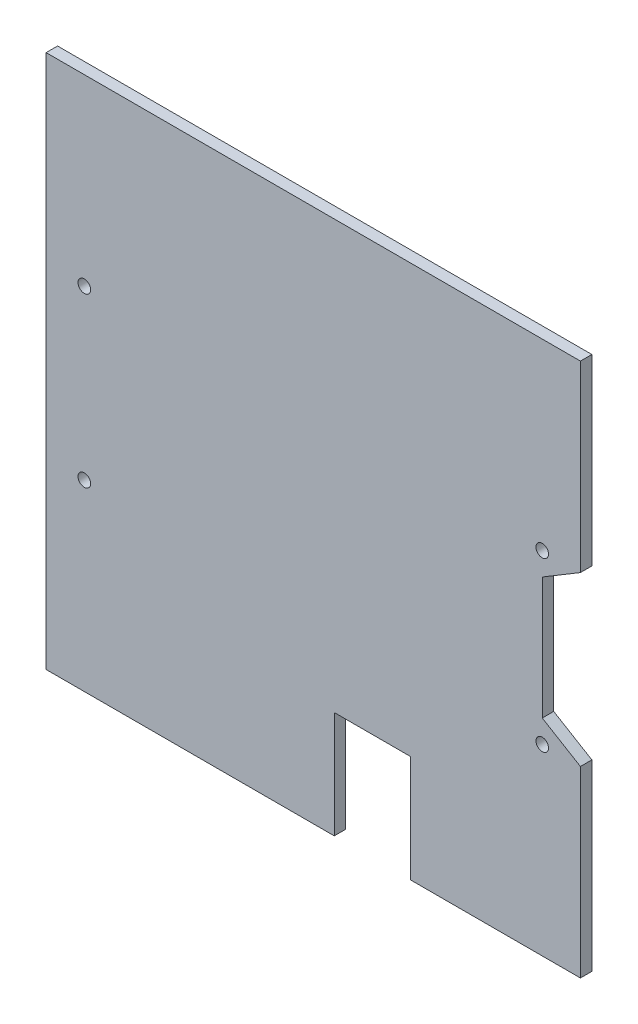
from build123d import *

# Parameters (mm, degrees)
SKETCH1_R           = 1.65
BOSS_EXTRUDE1_DEPTH = 3


with BuildPart() as part:
    # Sketch1 → Boss-Extrude1 (new body)
    with BuildSketch(Plane.XY):
        Polygon((0, -26), (75.5, -26), (75.5, 2), (95.5, 2), (95.5, -26), (140, -26), (140, 22), (130, 28), (130, 60), (140, 66), (140, 114), (0, 114), align=None)
        with Locations((10, 22)):
            Circle(SKETCH1_R, mode=Mode.SUBTRACT)
        with Locations((130, 66)):
            Circle(SKETCH1_R, mode=Mode.SUBTRACT)
        with Locations((130, 22)):
            Circle(SKETCH1_R, mode=Mode.SUBTRACT)
        with Locations((10, 66)):
            Circle(SKETCH1_R, mode=Mode.SUBTRACT)
    extrude(amount=BOSS_EXTRUDE1_DEPTH)


solid = part.part
